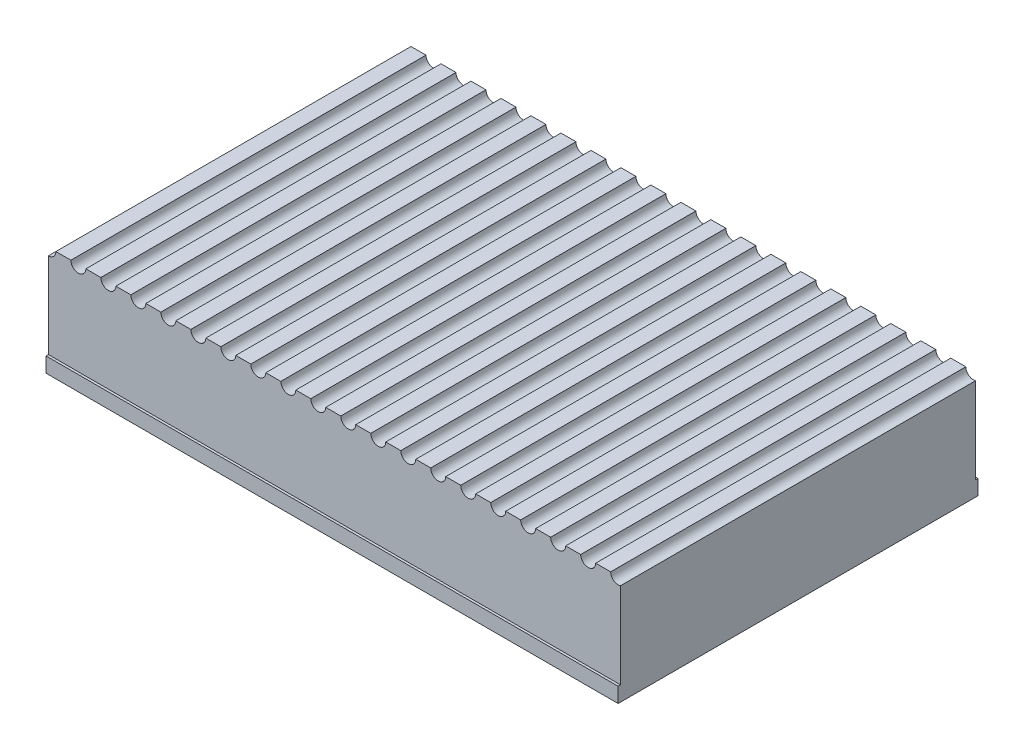
from build123d import *

# Parameters (mm, degrees)
SKETCH1_W           = 121.1453
SKETCH1_H           = 76.2
BOSS_EXTRUDE1_DEPTH = 3.175
SKETCH3_W           = 121.1453
SKETCH3_H           = 75.2
BOSS_EXTRUDE4_DEPTH = 19.685
SKETCH4_R           = 1.5875
CUT_EXTRUDE1_DEPTH  = 145.669462265


with BuildPart() as part:
    # Sketch1 → Boss-Extrude1 (new body)
    with BuildSketch(Plane(origin=(0, 0, 0), x_dir=(1, 0, 0), z_dir=(0, 1, 0))):
        with Locations((-60.57265, 38.1)):
            Rectangle(SKETCH1_W, SKETCH1_H)
    extrude(amount=BOSS_EXTRUDE1_DEPTH)

    # Sketch3 → Boss-Extrude4 (add)
    with BuildSketch(Plane(origin=(0, 3.175, 0), x_dir=(1, 0, 0), z_dir=(0, 1, 0))):
        with Locations((-60.57265, 38.1)):
            Rectangle(SKETCH3_W, SKETCH3_H)
    extrude(amount=BOSS_EXTRUDE4_DEPTH)

    # Sketch4 → Cut-Extrude1 (cut, through all)
    with BuildSketch(Plane.XY.offset(-0.5)):
        with Locations((-121.1453, 22.86)):
            Circle(SKETCH4_R)
        with Locations((-114.7953, 22.86)):
            Circle(SKETCH4_R)
        with Locations((-108.4453, 22.86)):
            Circle(SKETCH4_R)
        with Locations((-102.0953, 22.86)):
            Circle(SKETCH4_R)
        with Locations((-95.7453, 22.86)):
            Circle(SKETCH4_R)
        with Locations((-89.3953, 22.86)):
            Circle(SKETCH4_R)
        with Locations((-83.0453, 22.86)):
            Circle(SKETCH4_R)
        with Locations((-76.6953, 22.86)):
            Circle(SKETCH4_R)
        with Locations((-70.3453, 22.86)):
            Circle(SKETCH4_R)
        with Locations((-63.9953, 22.86)):
            Circle(SKETCH4_R)
        with Locations((-57.6453, 22.86)):
            Circle(SKETCH4_R)
        with Locations((-51.2953, 22.86)):
            Circle(SKETCH4_R)
        with Locations((-44.9453, 22.86)):
            Circle(SKETCH4_R)
        with Locations((-38.5953, 22.86)):
            Circle(SKETCH4_R)
        with Locations((-32.2453, 22.86)):
            Circle(SKETCH4_R)
        with Locations((-25.8953, 22.86)):
            Circle(SKETCH4_R)
        with Locations((-19.5453, 22.86)):
            Circle(SKETCH4_R)
        with Locations((-13.1953, 22.86)):
            Circle(SKETCH4_R)
        with Locations((-6.8453, 22.86)):
            Circle(SKETCH4_R)
        with Locations((-0.4953, 22.86)):
            Circle(SKETCH4_R)
        with Locations((5.8547, 22.86)):
            Circle(SKETCH4_R)
    extrude(amount=-CUT_EXTRUDE1_DEPTH, mode=Mode.SUBTRACT)


solid = part.part
